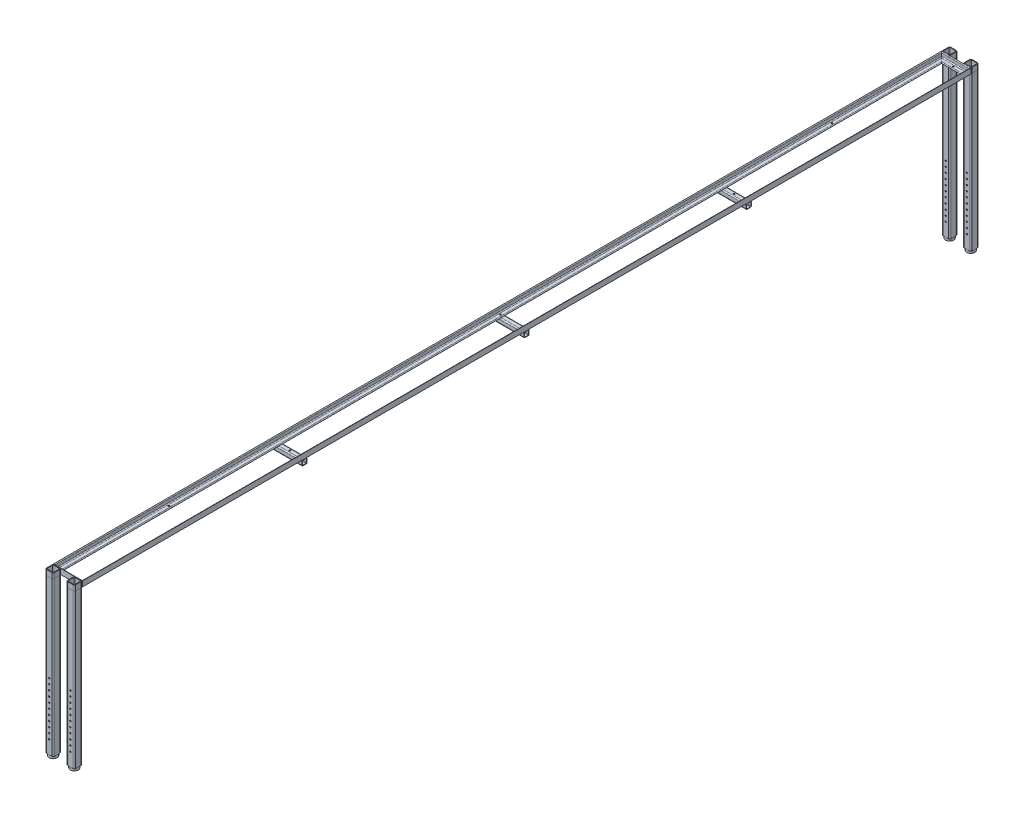
from build123d import *

# Parameters (mm, degrees)
ANGLE_IRON_20_X_20_X_3_2_DEPTH       = 3379.284271247
ANGLE_IRON_20_X_20_X_3_2_DEPTH_BACK  = 29.284271247
ANGLE_IRON_20_X_20_X_3_2_2_DEPTH     = 168.568542495
ANGLE_IRON_20_X_20_X_3_2_3_DEPTH     = 3408.568542495
ANGLE_IRON_20_X_20_X_3_2_4_DEPTH     = 168.568542495
SQUARE_TUBE_20_X_20_X_2_1_DEPTH      = 110
SQUARE_TUBE_20_X_20_X_2_2_DEPTH      = 110
CUT_EXTRUDE1_DEPTH                   = 1920.05982343
CUT_EXTRUDE1_DEPTH_BACK              = 1920.05982343
SKETCH18_R                           = 2.5
CUT_EXTRUDE2_DEPTH                   = 1920.05982343
CUT_EXTRUDE2_DEPTH_BACK              = 1920.05982343
SKETCH19_R                           = 2.5
CUT_EXTRUDE3_DEPTH                   = 1920.093433343
CUT_EXTRUDE3_DEPTH_BACK              = 1920.093433343
SKETCH20_R                           = 2
CUT_EXTRUDE4_DEPTH                   = 1920.093433343
CUT_EXTRUDE4_DEPTH_BACK              = 1920.093433343
SKETCH21_R                           = 2.5
SKETCH22_R                           = 2.5
CUT_EXTRUDE5_DEPTH                   = 1920.093433343
LPATTERN1_COUNT                      = 2
LPATTERN1_PITCH                      = 86.5
SKETCH23_R                           = 2.5
CUT_EXTRUDE6_DEPTH                   = 1920.093433343
LPATTERN2_COUNT                      = 2
LPATTERN2_PITCH                      = 86.5
SKETCH24_R                           = 2.5
CUT_EXTRUDE7_DEPTH                   = 1920.093433343
LPATTERN3_COUNT                      = 2
LPATTERN3_PITCH                      = 86.5
SQUARE_TUBE_30_X_30_X_2_6_2_DEPTH    = 580
SQUARE_TUBE_30_X_30_X_2_6_2_2_DEPTH  = 580
SQUARE_TUBE_30_X_30_X_2_6_3_DEPTH    = 580
SQUARE_TUBE_30_X_30_X_2_6_3_2_DEPTH  = 580
SKETCH121_R                          = 2.5
CUT_EXTRUDE9_DEPTH                   = 3493.914694421
LPATTERN5_COUNT                      = 11
LPATTERN5_PITCH                      = 20
SKETCH122_R                          = 2.5
CUT_EXTRUDE10_DEPTH                  = 3493.914694421
LPATTERN6_COUNT                      = 11
LPATTERN6_PITCH                      = 20
SQUARE_TUBE_30_X_30_X_2_6_15_DEPTH   = 20
SQUARE_TUBE_30_X_30_X_2_6_15_2_DEPTH = 20
SQUARE_TUBE_30_X_30_X_2_6_17_DEPTH   = 20
SQUARE_TUBE_30_X_30_X_2_6_17_2_DEPTH = 20
SQUARE_TUBE_30_X_30_X_2_6_17_3_DEPTH = 20
SQUARE_TUBE_20_X_20_X_2_7_DEPTH      = 110
SKETCH134_R                          = 2.5
CUT_EXTRUDE11_DEPTH                  = 39
SKETCH135_R                          = 2.5
CUT_EXTRUDE12_DEPTH                  = 39
SKETCH126_R                          = 15
SKETCH126_R_2                        = 12.4
BOSS_EXTRUDE1_DEPTH                  = 10
SKETCH125_R                          = 15
SKETCH125_R_2                        = 12.4
BOSS_EXTRUDE2_DEPTH                  = 10
SKETCH123_R                          = 15
SKETCH123_R_2                        = 12.4
BOSS_EXTRUDE3_DEPTH                  = 10
SKETCH124_R                          = 15
SKETCH124_R_2                        = 12.4
BOSS_EXTRUDE4_DEPTH                  = 10


with BuildPart() as part:
    # Sketch1 → Angle iron 20 X 20 X 3(2) (new, two sides: drawn at the far end of the back side and taken through both)
    with BuildSketch(Plane(origin=(485.75, 0, 1856.458333333), x_dir=(-1, 0, 0), z_dir=(0, 0, -1)).offset(-ANGLE_IRON_20_X_20_X_3_2_DEPTH_BACK)):
        with BuildLine():
            Line((0, 0), (0, 20))
            ThreePointArc((0, 20), (2.121320344, 19.121320344), (3, 17))
            Line((3, 17), (3, 6.5))
            ThreePointArc((3, 6.5), (4.025126266, 4.025126266), (6.5, 3))
            Line((6.5, 3), (17, 3))
            ThreePointArc((17, 3), (19.121320344, 2.121320344), (20, 0))
            Line((20, 0), (0, 0))
        make_face()
    extrude(amount=ANGLE_IRON_20_X_20_X_3_2_DEPTH + ANGLE_IRON_20_X_20_X_3_2_DEPTH_BACK)

    # Angle iron 20 X 20 X 3(2) mitre 1
    split(bisect_by=Plane(origin=(485.75, 0, 1856.458333333), x_dir=(0, 1, 0), z_dir=(0.707106781, 0, -0.707106781)), keep=Keep.TOP)

    # Angle iron 20 X 20 X 3(2) mitre 2
    split(bisect_by=Plane(origin=(485.75, 0, -1493.541666667), x_dir=(0, 1, 0), z_dir=(0.707106781, 0, 0.707106781)), keep=Keep.TOP)


with BuildPart() as body_2:
    # Sketch1 on segment 2 (carried to segment 2) → Angle iron 20 X 20 X 3_2 2 (new body)
    with BuildSketch(Plane(origin=(515.034271247, 0, -1493.541666667), x_dir=(0, 0, 1), z_dir=(-1, 0, 0))):
        with BuildLine():
            Line((0, 0), (0, 20))
            ThreePointArc((0, 20), (2.121320344, 19.121320344), (3, 17))
            Line((3, 17), (3, 6.5))
            ThreePointArc((3, 6.5), (4.025126266, 4.025126266), (6.5, 3))
            Line((6.5, 3), (17, 3))
            ThreePointArc((17, 3), (19.121320344, 2.121320344), (20, 0))
            Line((20, 0), (0, 0))
        make_face()
    extrude(amount=ANGLE_IRON_20_X_20_X_3_2_2_DEPTH)

    # Angle iron 20 X 20 X 3_2 2 mitre 1
    split(bisect_by=Plane(origin=(375.75, 0, -1493.541666667), x_dir=(0, 1, 0), z_dir=(0.707106781, 0, -0.707106781)), keep=Keep.TOP)

    # Angle iron 20 X 20 X 3_2 2 mitre 2
    split(bisect_by=Plane(origin=(485.75, 0, -1493.541666667), x_dir=(0, -1, 0), z_dir=(-0.707106781, 0, -0.707106781)), keep=Keep.TOP)

    # Sketch21 → Cut-Extrude4 (cut, two sides: drawn at the far end of the back side and taken through both)
    with BuildSketch(Plane(origin=(0, 3, 0), x_dir=(1, 0, 0), z_dir=(0, 1, 0)).offset(-CUT_EXTRUDE4_DEPTH_BACK)):
        with Locations(Location((430.75, 1481.791666667, 0), (0, 0, 270))):
            Circle(SKETCH21_R)
    extrude(amount=CUT_EXTRUDE4_DEPTH + CUT_EXTRUDE4_DEPTH_BACK, mode=Mode.SUBTRACT)


with BuildPart() as body_3:
    # Sketch1 on segment 3 (carried to segment 3) → Angle iron 20 X 20 X 3_2 3 (new body)
    with BuildSketch(Plane(origin=(375.75, 0, -1522.825937914), x_dir=(1, 0, 0), z_dir=(0, 0, 1))):
        with BuildLine():
            Line((0, 0), (0, 20))
            ThreePointArc((0, 20), (2.121320344, 19.121320344), (3, 17))
            Line((3, 17), (3, 6.5))
            ThreePointArc((3, 6.5), (4.025126266, 4.025126266), (6.5, 3))
            Line((6.5, 3), (17, 3))
            ThreePointArc((17, 3), (19.121320344, 2.121320344), (20, 0))
            Line((20, 0), (0, 0))
        make_face()
    extrude(amount=ANGLE_IRON_20_X_20_X_3_2_3_DEPTH)

    # Angle iron 20 X 20 X 3_2 3 mitre 1
    split(bisect_by=Plane(origin=(375.75, 0, 1856.458333333), x_dir=(0, -1, 0), z_dir=(-0.707106781, 0, -0.707106781)), keep=Keep.TOP)

    # Angle iron 20 X 20 X 3_2 3 mitre 2
    split(bisect_by=Plane(origin=(375.75, 0, -1493.541666667), x_dir=(0, -1, 0), z_dir=(-0.707106781, 0, 0.707106781)), keep=Keep.TOP)

    # Sketch22 → Cut-Extrude5 (cut, symmetric)
    with BuildSketch(Plane(origin=(0, 3, 0), x_dir=(1, 0, 0), z_dir=(0, 1, 0))):
        with Locations(Location((387.5, 1068.291666667, 0), (0, 0, 180))):
            Circle(SKETCH22_R)
    cut_extrude5 = extrude(amount=CUT_EXTRUDE5_DEPTH, both=True, mode=Mode.SUBTRACT)


with BuildPart() as body_4:
    # Sketch1 on segment 4 (carried to segment 4) → Angle iron 20 X 20 X 3_2 4 (new body)
    with BuildSketch(Plane(origin=(346.465728753, 0, 1856.458333333), x_dir=(0, 0, -1), z_dir=(1, 0, 0))):
        with BuildLine():
            Line((0, 0), (0, 20))
            ThreePointArc((0, 20), (2.121320344, 19.121320344), (3, 17))
            Line((3, 17), (3, 6.5))
            ThreePointArc((3, 6.5), (4.025126266, 4.025126266), (6.5, 3))
            Line((6.5, 3), (17, 3))
            ThreePointArc((17, 3), (19.121320344, 2.121320344), (20, 0))
            Line((20, 0), (0, 0))
        make_face()
    extrude(amount=ANGLE_IRON_20_X_20_X_3_2_4_DEPTH)

    # Angle iron 20 X 20 X 3_2 4 mitre 1
    split(bisect_by=Plane(origin=(375.75, 0, 1856.458333333), x_dir=(0, 1, 0), z_dir=(0.707106781, 0, 0.707106781)), keep=Keep.TOP)

    # Angle iron 20 X 20 X 3_2 4 mitre 2
    split(bisect_by=Plane(origin=(485.75, 0, 1856.458333333), x_dir=(0, -1, 0), z_dir=(-0.707106781, 0, 0.707106781)), keep=Keep.TOP)

    # Sketch20 → Cut-Extrude3 (cut, two sides: drawn at the far end of the back side and taken through both)
    with BuildSketch(Plane(origin=(0, 3, 0), x_dir=(1, 0, 0), z_dir=(0, 1, 0)).offset(-CUT_EXTRUDE3_DEPTH_BACK)):
        with Locations(Location((430.75, -1844.708333333, 0), (0, 0, 270))):
            Circle(SKETCH20_R)
    extrude(amount=CUT_EXTRUDE3_DEPTH + CUT_EXTRUDE3_DEPTH_BACK, mode=Mode.SUBTRACT)


with BuildPart() as body_5:
    # Sketch13 → Square tube 20 X 20 X 2(1) (new body)
    with BuildSketch(Plane(origin=(375.75, -10, -656.041666667), x_dir=(0, 0, 1), z_dir=(1, 0, 0))):
        with BuildLine():
            Line((-6, -10), (6, -10))
            ThreePointArc((6, -10), (8.828427125, -8.828427125), (10, -6))
            Line((10, -6), (10, 6))
            ThreePointArc((10, 6), (8.828427125, 8.828427125), (6, 10))
            Line((6, 10), (-6, 10))
            ThreePointArc((-6, 10), (-8.828427125, 8.828427125), (-10, 6))
            Line((-10, 6), (-10, -6))
            ThreePointArc((-10, -6), (-8.828427125, -8.828427125), (-6, -10))
        make_face()
        with BuildLine():
            Line((-6, -8), (6, -8))
            ThreePointArc((6, -8), (7.414213562, -7.414213562), (8, -6))
            Line((8, -6), (8, 6))
            ThreePointArc((8, 6), (7.414213562, 7.414213562), (6, 8))
            Line((6, 8), (-6, 8))
            ThreePointArc((-6, 8), (-7.414213562, 7.414213562), (-8, 6))
            Line((-8, 6), (-8, -6))
            ThreePointArc((-8, -6), (-7.414213562, -7.414213562), (-6, -8))
        make_face(mode=Mode.SUBTRACT)
    extrude(amount=SQUARE_TUBE_20_X_20_X_2_1_DEPTH)

    # Sketch18 → Cut-Extrude1 (cut, two sides: drawn at the far end of the back side and taken through both)
    with BuildSketch(Plane(origin=(0, 0, 0), x_dir=(1, 0, 0), z_dir=(0, 1, 0)).offset(-CUT_EXTRUDE1_DEPTH_BACK)):
        with Locations(Location((430.75, 656.041666667, 0), (0, 0, 90))):
            Circle(SKETCH18_R)
    extrude(amount=CUT_EXTRUDE1_DEPTH + CUT_EXTRUDE1_DEPTH_BACK, mode=Mode.SUBTRACT)


with BuildPart() as body_6:
    # Sketch15 → Square tube 20 X 20 X 2(2) (new body)
    with BuildSketch(Plane(origin=(375.75, -10, 1018.958333333), x_dir=(0, 0, 1), z_dir=(1, 0, 0))):
        with BuildLine():
            Line((-6, -10), (6, -10))
            ThreePointArc((6, -10), (8.828427125, -8.828427125), (10, -6))
            Line((10, -6), (10, 6))
            ThreePointArc((10, 6), (8.828427125, 8.828427125), (6, 10))
            Line((6, 10), (-6, 10))
            ThreePointArc((-6, 10), (-8.828427125, 8.828427125), (-10, 6))
            Line((-10, 6), (-10, -6))
            ThreePointArc((-10, -6), (-8.828427125, -8.828427125), (-6, -10))
        make_face()
        with BuildLine():
            Line((-6, -8), (6, -8))
            ThreePointArc((6, -8), (7.414213562, -7.414213562), (8, -6))
            Line((8, -6), (8, 6))
            ThreePointArc((8, 6), (7.414213562, 7.414213562), (6, 8))
            Line((6, 8), (-6, 8))
            ThreePointArc((-6, 8), (-7.414213562, 7.414213562), (-8, 6))
            Line((-8, 6), (-8, -6))
            ThreePointArc((-8, -6), (-7.414213562, -7.414213562), (-6, -8))
        make_face(mode=Mode.SUBTRACT)
    extrude(amount=SQUARE_TUBE_20_X_20_X_2_2_DEPTH)

    # Sketch19 → Cut-Extrude2 (cut, two sides: drawn at the far end of the back side and taken through both)
    with BuildSketch(Plane(origin=(0, 0, 0), x_dir=(1, 0, 0), z_dir=(0, 1, 0)).offset(-CUT_EXTRUDE2_DEPTH_BACK)):
        with Locations(Location((430.75, -1018.958333333, 0), (0, 0, 90))):
            Circle(SKETCH19_R)
    extrude(amount=CUT_EXTRUDE2_DEPTH + CUT_EXTRUDE2_DEPTH_BACK, mode=Mode.SUBTRACT)


with BuildPart() as part_1:
    add(part.part)

    # LPattern1: Cut-Extrude5 ×2
    with Locations(*[(i * LPATTERN1_PITCH, 0, 0) for i in range(1, LPATTERN1_COUNT)]):
        add(cut_extrude5, mode=Mode.SUBTRACT)

    # Sketch23 → Cut-Extrude6 (cut, symmetric)
    with BuildSketch(Plane(origin=(0, 3, 0), x_dir=(1, 0, 0), z_dir=(0, 1, 0))):
        with Locations(Location((474, -1431.208333333, 0), (0, 0, 180))):
            Circle(SKETCH23_R)
    cut_extrude6 = extrude(amount=CUT_EXTRUDE6_DEPTH, both=True, mode=Mode.SUBTRACT)


with BuildPart() as body_3_1:
    add(body_3.part)

    # LPattern2: Cut-Extrude6 ×2
    with Locations(*[(-i * LPATTERN2_PITCH, 0, 0) for i in range(1, LPATTERN2_COUNT)]):
        add(cut_extrude6, mode=Mode.SUBTRACT)

    # Sketch24 → Cut-Extrude7 (cut, symmetric)
    with BuildSketch(Plane(origin=(0, 3, 0), x_dir=(1, 0, 0), z_dir=(0, 1, 0))):
        with Locations(Location((387.5, -181.958333333, 0), (0, 0, 90))):
            Circle(SKETCH24_R)
    cut_extrude7 = extrude(amount=CUT_EXTRUDE7_DEPTH, both=True, mode=Mode.SUBTRACT)


with BuildPart() as part_2:
    add(part_1.part)

    # LPattern3: Cut-Extrude7 ×2
    with Locations(*[(i * LPATTERN3_PITCH, 0, 0) for i in range(1, LPATTERN3_COUNT)]):
        add(cut_extrude7, mode=Mode.SUBTRACT)


with BuildPart() as body_7:
    # Sketch118 → Square tube 30 X 30 X 2.6(2) (new body)
    with BuildSketch(Plane(origin=(470.75, 0, -1508.541666667), x_dir=(-1, 0, 0), z_dir=(0, -1, 0))):
        with BuildLine():
            Line((-9.8, -15), (9.8, -15))
            ThreePointArc((9.8, -15), (13.476955262, -13.476955262), (15, -9.8))
            Line((15, -9.8), (15, 9.8))
            ThreePointArc((15, 9.8), (13.476955262, 13.476955262), (9.8, 15))
            Line((9.8, 15), (-9.8, 15))
            ThreePointArc((-9.8, 15), (-13.476955262, 13.476955262), (-15, 9.8))
            Line((-15, 9.8), (-15, -9.8))
            ThreePointArc((-15, -9.8), (-13.476955262, -13.476955262), (-9.8, -15))
        make_face()
        with BuildLine():
            Line((-9.8, -12.4), (9.8, -12.4))
            ThreePointArc((9.8, -12.4), (11.638477631, -11.638477631), (12.4, -9.8))
            Line((12.4, -9.8), (12.4, 9.8))
            ThreePointArc((12.4, 9.8), (11.638477631, 11.638477631), (9.8, 12.4))
            Line((9.8, 12.4), (-9.8, 12.4))
            ThreePointArc((-9.8, 12.4), (-11.638477631, 11.638477631), (-12.4, 9.8))
            Line((-12.4, 9.8), (-12.4, -9.8))
            ThreePointArc((-12.4, -9.8), (-11.638477631, -11.638477631), (-9.8, -12.4))
        make_face(mode=Mode.SUBTRACT)
    extrude(amount=SQUARE_TUBE_30_X_30_X_2_6_2_DEPTH)


with BuildPart() as body_8:
    # Sketch118 on segment 2 (carried to segment 2) → Square tube 30 X 30 X 2.6_2 2 (new body)
    with BuildSketch(Plane(origin=(390.75, 0, -1508.541666667), x_dir=(-1, 0, 0), z_dir=(0, -1, 0))):
        with BuildLine():
            Line((-9.8, -15), (9.8, -15))
            ThreePointArc((9.8, -15), (13.476955262, -13.476955262), (15, -9.8))
            Line((15, -9.8), (15, 9.8))
            ThreePointArc((15, 9.8), (13.476955262, 13.476955262), (9.8, 15))
            Line((9.8, 15), (-9.8, 15))
            ThreePointArc((-9.8, 15), (-13.476955262, 13.476955262), (-15, 9.8))
            Line((-15, 9.8), (-15, -9.8))
            ThreePointArc((-15, -9.8), (-13.476955262, -13.476955262), (-9.8, -15))
        make_face()
        with BuildLine():
            Line((-9.8, -12.4), (9.8, -12.4))
            ThreePointArc((9.8, -12.4), (11.638477631, -11.638477631), (12.4, -9.8))
            Line((12.4, -9.8), (12.4, 9.8))
            ThreePointArc((12.4, 9.8), (11.638477631, 11.638477631), (9.8, 12.4))
            Line((9.8, 12.4), (-9.8, 12.4))
            ThreePointArc((-9.8, 12.4), (-11.638477631, 11.638477631), (-12.4, 9.8))
            Line((-12.4, 9.8), (-12.4, -9.8))
            ThreePointArc((-12.4, -9.8), (-11.638477631, -11.638477631), (-9.8, -12.4))
        make_face(mode=Mode.SUBTRACT)
    extrude(amount=SQUARE_TUBE_30_X_30_X_2_6_2_2_DEPTH)


with BuildPart() as body_9:
    # Sketch120 → Square tube 30 X 30 X 2.6(3) (new body)
    with BuildSketch(Plane(origin=(470.75, 0, 1871.458333333), x_dir=(1, 0, 0), z_dir=(0, -1, 0))):
        with BuildLine():
            Line((-9.8, -15), (9.8, -15))
            ThreePointArc((9.8, -15), (13.476955262, -13.476955262), (15, -9.8))
            Line((15, -9.8), (15, 9.8))
            ThreePointArc((15, 9.8), (13.476955262, 13.476955262), (9.8, 15))
            Line((9.8, 15), (-9.8, 15))
            ThreePointArc((-9.8, 15), (-13.476955262, 13.476955262), (-15, 9.8))
            Line((-15, 9.8), (-15, -9.8))
            ThreePointArc((-15, -9.8), (-13.476955262, -13.476955262), (-9.8, -15))
        make_face()
        with BuildLine():
            Line((-9.8, -12.4), (9.8, -12.4))
            ThreePointArc((9.8, -12.4), (11.638477631, -11.638477631), (12.4, -9.8))
            Line((12.4, -9.8), (12.4, 9.8))
            ThreePointArc((12.4, 9.8), (11.638477631, 11.638477631), (9.8, 12.4))
            Line((9.8, 12.4), (-9.8, 12.4))
            ThreePointArc((-9.8, 12.4), (-11.638477631, 11.638477631), (-12.4, 9.8))
            Line((-12.4, 9.8), (-12.4, -9.8))
            ThreePointArc((-12.4, -9.8), (-11.638477631, -11.638477631), (-9.8, -12.4))
        make_face(mode=Mode.SUBTRACT)
    extrude(amount=SQUARE_TUBE_30_X_30_X_2_6_3_DEPTH)


with BuildPart() as body_10:
    # Sketch120 on segment 2 (carried to segment 2) → Square tube 30 X 30 X 2.6_3 2 (new body)
    with BuildSketch(Plane(origin=(390.75, 0, 1871.458333333), x_dir=(1, 0, 0), z_dir=(0, -1, 0))):
        with BuildLine():
            Line((-9.8, -15), (9.8, -15))
            ThreePointArc((9.8, -15), (13.476955262, -13.476955262), (15, -9.8))
            Line((15, -9.8), (15, 9.8))
            ThreePointArc((15, 9.8), (13.476955262, 13.476955262), (9.8, 15))
            Line((9.8, 15), (-9.8, 15))
            ThreePointArc((-9.8, 15), (-13.476955262, 13.476955262), (-15, 9.8))
            Line((-15, 9.8), (-15, -9.8))
            ThreePointArc((-15, -9.8), (-13.476955262, -13.476955262), (-9.8, -15))
        make_face()
        with BuildLine():
            Line((-9.8, -12.4), (9.8, -12.4))
            ThreePointArc((9.8, -12.4), (11.638477631, -11.638477631), (12.4, -9.8))
            Line((12.4, -9.8), (12.4, 9.8))
            ThreePointArc((12.4, 9.8), (11.638477631, 11.638477631), (9.8, 12.4))
            Line((9.8, 12.4), (-9.8, 12.4))
            ThreePointArc((-9.8, 12.4), (-11.638477631, 11.638477631), (-12.4, 9.8))
            Line((-12.4, 9.8), (-12.4, -9.8))
            ThreePointArc((-12.4, -9.8), (-11.638477631, -11.638477631), (-9.8, -12.4))
        make_face(mode=Mode.SUBTRACT)
    extrude(amount=SQUARE_TUBE_30_X_30_X_2_6_3_2_DEPTH)


with BuildPart() as cut_extrude9_tool:
    # Sketch121 → Cut-Extrude9 (new, symmetric)
    with BuildSketch(Plane.XY.offset(1886.458333333)):
        with Locations(Location((470.75, -530, 0), (0, 0, 180))):
            Circle(SKETCH121_R)
    cut_extrude9 = extrude(amount=CUT_EXTRUDE9_DEPTH, both=True)


with BuildPart() as body_7_1:
    add(body_7.part)

    # Cut-Extrude9: cut by cut_extrude9_tool
    add(cut_extrude9_tool.part, mode=Mode.SUBTRACT)


with BuildPart() as body_9_1:
    add(body_9.part)

    # Cut-Extrude9: cut by cut_extrude9_tool
    add(cut_extrude9_tool.part, mode=Mode.SUBTRACT)


with BuildPart() as lpattern5_tool:
    # LPattern5: Cut-Extrude9 ×11
    with Locations(*[(0, i * LPATTERN5_PITCH, 0) for i in range(1, LPATTERN5_COUNT)]):
        add(cut_extrude9)


with BuildPart() as body_7_2:
    add(body_7_1.part)

    # LPattern5: cut by lpattern5_tool
    add(lpattern5_tool.part, mode=Mode.SUBTRACT)


with BuildPart() as body_9_2:
    add(body_9_1.part)

    # LPattern5: cut by lpattern5_tool
    add(lpattern5_tool.part, mode=Mode.SUBTRACT)


with BuildPart() as cut_extrude10_tool:
    # Sketch122 → Cut-Extrude10 (new, through all)
    with BuildSketch(Plane.XY.offset(1886.458333333)):
        with Locations((390.75, -530)):
            Circle(SKETCH122_R)
    cut_extrude10 = extrude(amount=-CUT_EXTRUDE10_DEPTH)


with BuildPart() as body_8_1:
    add(body_8.part)

    # Cut-Extrude10: cut by cut_extrude10_tool
    add(cut_extrude10_tool.part, mode=Mode.SUBTRACT)


with BuildPart() as body_10_1:
    add(body_10.part)

    # Cut-Extrude10: cut by cut_extrude10_tool
    add(cut_extrude10_tool.part, mode=Mode.SUBTRACT)


with BuildPart() as lpattern6_tool:
    # LPattern6: Cut-Extrude10 ×11
    with Locations(*[(0, i * LPATTERN6_PITCH, 0) for i in range(1, LPATTERN6_COUNT)]):
        add(cut_extrude10)


with BuildPart() as body_8_2:
    add(body_8_1.part)

    # LPattern6: cut by lpattern6_tool
    add(lpattern6_tool.part, mode=Mode.SUBTRACT)


with BuildPart() as body_10_2:
    add(body_10_1.part)

    # LPattern6: cut by lpattern6_tool
    add(lpattern6_tool.part, mode=Mode.SUBTRACT)


with BuildPart() as body_11:
    # Sketch128 → Square tube 30 X 30 X 2.6(15) (new body)
    with BuildSketch(Plane(origin=(470.75, 0, -1508.541666667), x_dir=(1, 0, 0), z_dir=(0, 1, 0))):
        with BuildLine():
            Line((-9.8, -15), (9.8, -15))
            ThreePointArc((9.8, -15), (13.476955262, -13.476955262), (15, -9.8))
            Line((15, -9.8), (15, 9.8))
            ThreePointArc((15, 9.8), (13.476955262, 13.476955262), (9.8, 15))
            Line((9.8, 15), (-9.8, 15))
            ThreePointArc((-9.8, 15), (-13.476955262, 13.476955262), (-15, 9.8))
            Line((-15, 9.8), (-15, -9.8))
            ThreePointArc((-15, -9.8), (-13.476955262, -13.476955262), (-9.8, -15))
        make_face()
        with BuildLine():
            Line((-9.8, -12.4), (9.8, -12.4))
            ThreePointArc((9.8, -12.4), (11.638477631, -11.638477631), (12.4, -9.8))
            Line((12.4, -9.8), (12.4, 9.8))
            ThreePointArc((12.4, 9.8), (11.638477631, 11.638477631), (9.8, 12.4))
            Line((9.8, 12.4), (-9.8, 12.4))
            ThreePointArc((-9.8, 12.4), (-11.638477631, 11.638477631), (-12.4, 9.8))
            Line((-12.4, 9.8), (-12.4, -9.8))
            ThreePointArc((-12.4, -9.8), (-11.638477631, -11.638477631), (-9.8, -12.4))
        make_face(mode=Mode.SUBTRACT)
    extrude(amount=SQUARE_TUBE_30_X_30_X_2_6_15_DEPTH)


with BuildPart() as body_12:
    # Sketch128 on segment 2 (carried to segment 2) → Square tube 30 X 30 X 2.6_15 2 (new body)
    with BuildSketch(Plane(origin=(390.75, 0, -1508.541666667), x_dir=(1, 0, 0), z_dir=(0, 1, 0))):
        with BuildLine():
            Line((-9.8, -15), (9.8, -15))
            ThreePointArc((9.8, -15), (13.476955262, -13.476955262), (15, -9.8))
            Line((15, -9.8), (15, 9.8))
            ThreePointArc((15, 9.8), (13.476955262, 13.476955262), (9.8, 15))
            Line((9.8, 15), (-9.8, 15))
            ThreePointArc((-9.8, 15), (-13.476955262, 13.476955262), (-15, 9.8))
            Line((-15, 9.8), (-15, -9.8))
            ThreePointArc((-15, -9.8), (-13.476955262, -13.476955262), (-9.8, -15))
        make_face()
        with BuildLine():
            Line((-9.8, -12.4), (9.8, -12.4))
            ThreePointArc((9.8, -12.4), (11.638477631, -11.638477631), (12.4, -9.8))
            Line((12.4, -9.8), (12.4, 9.8))
            ThreePointArc((12.4, 9.8), (11.638477631, 11.638477631), (9.8, 12.4))
            Line((9.8, 12.4), (-9.8, 12.4))
            ThreePointArc((-9.8, 12.4), (-11.638477631, 11.638477631), (-12.4, 9.8))
            Line((-12.4, 9.8), (-12.4, -9.8))
            ThreePointArc((-12.4, -9.8), (-11.638477631, -11.638477631), (-9.8, -12.4))
        make_face(mode=Mode.SUBTRACT)
    extrude(amount=SQUARE_TUBE_30_X_30_X_2_6_15_2_DEPTH)


with BuildPart() as body_13:
    # Sketch129 → Square tube 30 X 30 X 2.6(17) (new body)
    with BuildSketch(Plane(origin=(470.75, 0, -1508.541666667), x_dir=(1, 0, 0), z_dir=(0, 1, 0))):
        with BuildLine():
            Line((-9.8, -15), (9.8, -15))
            ThreePointArc((9.8, -15), (13.476955262, -13.476955262), (15, -9.8))
            Line((15, -9.8), (15, 9.8))
            ThreePointArc((15, 9.8), (13.476955262, 13.476955262), (9.8, 15))
            Line((9.8, 15), (-9.8, 15))
            ThreePointArc((-9.8, 15), (-13.476955262, 13.476955262), (-15, 9.8))
            Line((-15, 9.8), (-15, -9.8))
            ThreePointArc((-15, -9.8), (-13.476955262, -13.476955262), (-9.8, -15))
        make_face()
        with BuildLine():
            Line((-9.8, -12.4), (9.8, -12.4))
            ThreePointArc((9.8, -12.4), (11.638477631, -11.638477631), (12.4, -9.8))
            Line((12.4, -9.8), (12.4, 9.8))
            ThreePointArc((12.4, 9.8), (11.638477631, 11.638477631), (9.8, 12.4))
            Line((9.8, 12.4), (-9.8, 12.4))
            ThreePointArc((-9.8, 12.4), (-11.638477631, 11.638477631), (-12.4, 9.8))
            Line((-12.4, 9.8), (-12.4, -9.8))
            ThreePointArc((-12.4, -9.8), (-11.638477631, -11.638477631), (-9.8, -12.4))
        make_face(mode=Mode.SUBTRACT)
    extrude(amount=SQUARE_TUBE_30_X_30_X_2_6_17_DEPTH)


with BuildPart() as body_14:
    # Sketch129 on segment 2 (carried to segment 2) → Square tube 30 X 30 X 2.6_17 2 (new body)
    with BuildSketch(Plane(origin=(390.75, 0, 1871.458333333), x_dir=(1, 0, 0), z_dir=(0, 1, 0))):
        with BuildLine():
            Line((-9.8, -15), (9.8, -15))
            ThreePointArc((9.8, -15), (13.476955262, -13.476955262), (15, -9.8))
            Line((15, -9.8), (15, 9.8))
            ThreePointArc((15, 9.8), (13.476955262, 13.476955262), (9.8, 15))
            Line((9.8, 15), (-9.8, 15))
            ThreePointArc((-9.8, 15), (-13.476955262, 13.476955262), (-15, 9.8))
            Line((-15, 9.8), (-15, -9.8))
            ThreePointArc((-15, -9.8), (-13.476955262, -13.476955262), (-9.8, -15))
        make_face()
        with BuildLine():
            Line((-9.8, -12.4), (9.8, -12.4))
            ThreePointArc((9.8, -12.4), (11.638477631, -11.638477631), (12.4, -9.8))
            Line((12.4, -9.8), (12.4, 9.8))
            ThreePointArc((12.4, 9.8), (11.638477631, 11.638477631), (9.8, 12.4))
            Line((9.8, 12.4), (-9.8, 12.4))
            ThreePointArc((-9.8, 12.4), (-11.638477631, 11.638477631), (-12.4, 9.8))
            Line((-12.4, 9.8), (-12.4, -9.8))
            ThreePointArc((-12.4, -9.8), (-11.638477631, -11.638477631), (-9.8, -12.4))
        make_face(mode=Mode.SUBTRACT)
    extrude(amount=SQUARE_TUBE_30_X_30_X_2_6_17_2_DEPTH)


with BuildPart() as body_15:
    # Sketch129 on segment 3 (carried to segment 3) → Square tube 30 X 30 X 2.6_17 3 (new body)
    with BuildSketch(Plane(origin=(470.75, 0, 1871.458333333), x_dir=(1, 0, 0), z_dir=(0, 1, 0))):
        with BuildLine():
            Line((-9.8, -15), (9.8, -15))
            ThreePointArc((9.8, -15), (13.476955262, -13.476955262), (15, -9.8))
            Line((15, -9.8), (15, 9.8))
            ThreePointArc((15, 9.8), (13.476955262, 13.476955262), (9.8, 15))
            Line((9.8, 15), (-9.8, 15))
            ThreePointArc((-9.8, 15), (-13.476955262, 13.476955262), (-15, 9.8))
            Line((-15, 9.8), (-15, -9.8))
            ThreePointArc((-15, -9.8), (-13.476955262, -13.476955262), (-9.8, -15))
        make_face()
        with BuildLine():
            Line((-9.8, -12.4), (9.8, -12.4))
            ThreePointArc((9.8, -12.4), (11.638477631, -11.638477631), (12.4, -9.8))
            Line((12.4, -9.8), (12.4, 9.8))
            ThreePointArc((12.4, 9.8), (11.638477631, 11.638477631), (9.8, 12.4))
            Line((9.8, 12.4), (-9.8, 12.4))
            ThreePointArc((-9.8, 12.4), (-11.638477631, 11.638477631), (-12.4, 9.8))
            Line((-12.4, 9.8), (-12.4, -9.8))
            ThreePointArc((-12.4, -9.8), (-11.638477631, -11.638477631), (-9.8, -12.4))
        make_face(mode=Mode.SUBTRACT)
    extrude(amount=SQUARE_TUBE_30_X_30_X_2_6_17_3_DEPTH)


with BuildPart() as body_16:
    # Sketch132 → Square tube 20 X 20 X 2(7) (new body)
    with BuildSketch(Plane(origin=(485.75, -10, 181.458333333), x_dir=(0, 0, -1), z_dir=(-1, 0, 0))):
        with BuildLine():
            Line((-6, -10), (6, -10))
            ThreePointArc((6, -10), (8.828427125, -8.828427125), (10, -6))
            Line((10, -6), (10, 6))
            ThreePointArc((10, 6), (8.828427125, 8.828427125), (6, 10))
            Line((6, 10), (-6, 10))
            ThreePointArc((-6, 10), (-8.828427125, 8.828427125), (-10, 6))
            Line((-10, 6), (-10, -6))
            ThreePointArc((-10, -6), (-8.828427125, -8.828427125), (-6, -10))
        make_face()
        with BuildLine():
            Line((-6, -8), (6, -8))
            ThreePointArc((6, -8), (7.414213562, -7.414213562), (8, -6))
            Line((8, -6), (8, 6))
            ThreePointArc((8, 6), (7.414213562, 7.414213562), (6, 8))
            Line((6, 8), (-6, 8))
            ThreePointArc((-6, 8), (-7.414213562, 7.414213562), (-8, 6))
            Line((-8, 6), (-8, -6))
            ThreePointArc((-8, -6), (-7.414213562, -7.414213562), (-6, -8))
        make_face(mode=Mode.SUBTRACT)
    extrude(amount=SQUARE_TUBE_20_X_20_X_2_7_DEPTH)

    # Sketch134 → Cut-Extrude11 (cut)
    with BuildSketch(Plane(origin=(0, 3, 0), x_dir=(1, 0, 0), z_dir=(0, 1, 0))):
        with Locations(Location((387.5, -181.958333333, 0), (0, 0, 90))):
            Circle(SKETCH134_R)
    extrude(amount=-CUT_EXTRUDE11_DEPTH, mode=Mode.SUBTRACT)

    # Sketch135 → Cut-Extrude12 (cut)
    with BuildSketch(Plane(origin=(0, 3, 0), x_dir=(1, 0, 0), z_dir=(0, 1, 0))):
        with Locations(Location((474, -181.958333333, 0), (0, 0, 90))):
            Circle(SKETCH135_R)
    extrude(amount=-CUT_EXTRUDE12_DEPTH, mode=Mode.SUBTRACT)


with BuildPart() as body_17:
    # Sketch126 → Boss-Extrude1 (new body)
    with BuildSketch(Plane.XZ.offset(580)):
        with Locations((470.75, -1508.541666667)):
            Circle(SKETCH126_R)
        with Locations((470.75, -1508.541666667)):
            Circle(SKETCH126_R_2, mode=Mode.SUBTRACT)
    extrude(amount=BOSS_EXTRUDE1_DEPTH)


with BuildPart() as body_18:
    # Sketch125 → Boss-Extrude2 (new body)
    with BuildSketch(Plane.XZ.offset(580)):
        with Locations((390.75, -1508.541666667)):
            Circle(SKETCH125_R)
        with Locations((390.75, -1508.541666667)):
            Circle(SKETCH125_R_2, mode=Mode.SUBTRACT)
    extrude(amount=BOSS_EXTRUDE2_DEPTH)


with BuildPart() as body_19:
    # Sketch123 → Boss-Extrude3 (new body)
    with BuildSketch(Plane.XZ.offset(580)):
        with Locations((470.75, 1871.458333333)):
            Circle(SKETCH123_R)
        with Locations((470.75, 1871.458333333)):
            Circle(SKETCH123_R_2, mode=Mode.SUBTRACT)
    extrude(amount=BOSS_EXTRUDE3_DEPTH)


with BuildPart() as body_20:
    # Sketch124 → Boss-Extrude4 (new body)
    with BuildSketch(Plane.XZ.offset(580)):
        with Locations((390.75, 1871.458333333)):
            Circle(SKETCH124_R)
        with Locations((390.75, 1871.458333333)):
            Circle(SKETCH124_R_2, mode=Mode.SUBTRACT)
    extrude(amount=BOSS_EXTRUDE4_DEPTH)


solid = Compound([body_2.part, body_4.part, body_5.part, body_6.part, body_3_1.part, part_2.part, body_7_2.part, body_9_2.part, body_8_2.part, body_10_2.part, body_11.part, body_12.part, body_13.part, body_14.part, body_15.part, body_16.part, body_17.part, body_18.part, body_19.part, body_20.part])
